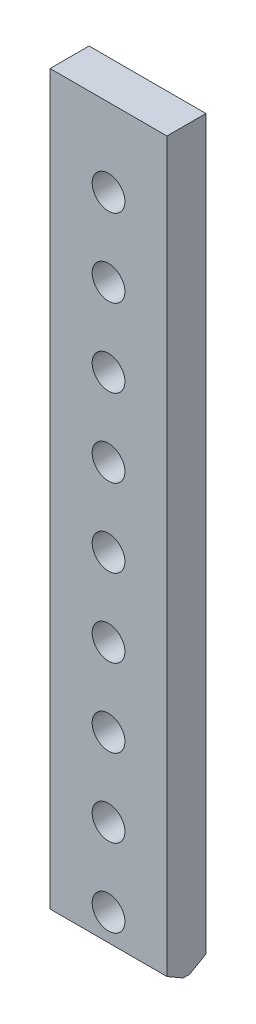
from build123d import *

# Parameters (mm, degrees)
SKETCH_1_W          = 75
SKETCH_1_H          = 473
EXTRUDE_1_DEPTH     = 25
SKETCH_2_R          = 10.5
CUT_EXTRUDE_1_DEPTH = 480.561257818
CHAMFER_1_SIZE      = 6
CHAMFER_1_SIZE2     = 10.392304845
CHAMFER_2_SIZE      = 6
CHAMFER_2_SIZE2     = 10.392304845


with BuildPart() as part:
    # Эскиз1 → Бобышка-Вытянуть1 (new body)
    with BuildSketch(Plane.XY):
        with Locations((37.5, 236.5)):
            Rectangle(SKETCH_1_W, SKETCH_1_H)
    extrude(amount=EXTRUDE_1_DEPTH)

    # Эскиз2 → Вырез-Вытянуть1 (cut, through all)
    with BuildSketch(Plane.XY.offset(25)):
        with Locations((37.5, 23)):
            Circle(SKETCH_2_R)
        with Locations((37.5, 73)):
            Circle(SKETCH_2_R)
        with Locations((37.5, 123)):
            Circle(SKETCH_2_R)
        with Locations((37.5, 173)):
            Circle(SKETCH_2_R)
        with Locations((37.5, 223)):
            Circle(SKETCH_2_R)
        with Locations((37.5, 273)):
            Circle(SKETCH_2_R)
        with Locations((37.5, 323)):
            Circle(SKETCH_2_R)
        with Locations((37.5, 373)):
            Circle(SKETCH_2_R)
        with Locations((37.5, 423)):
            Circle(SKETCH_2_R)
    extrude(amount=-CUT_EXTRUDE_1_DEPTH, mode=Mode.SUBTRACT)

    # Фаска1
    chamfer_1_edges = [part.edges().sort_by_distance(p)[0] for p in [
        (37.5, 0, 0),
    ]]
    chamfer_1_side = [part.faces().sort_by_distance(p)[0] for p in [
        (37.5, 237.800547955, 0),
    ]]
    chamfer(chamfer_1_edges, length=CHAMFER_1_SIZE, length2=CHAMFER_1_SIZE2, reference=chamfer_1_side[0])

    # Фаска2
    chamfer_2_edges = [part.edges().sort_by_distance(p)[0] for p in [
        (37.5, 0, 25),
    ]]
    chamfer_2_side = [part.faces().sort_by_distance(p)[0] for p in [
        (37.5, 237.800547955, 25),
    ]]
    chamfer(chamfer_2_edges, length=CHAMFER_2_SIZE, length2=CHAMFER_2_SIZE2, reference=chamfer_2_side[0])


solid = part.part
